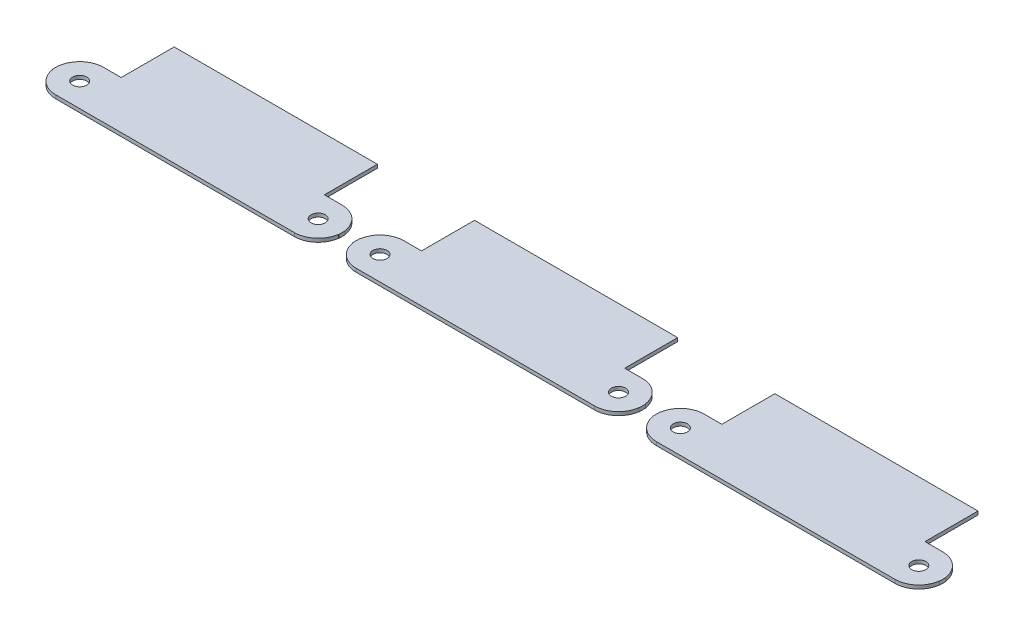
from build123d import *

# Parameters (mm, degrees)
SKETCH1_R           = 2
BOSS_EXTRUDE1_DEPTH = 1
LPATTERN1_COUNT     = 3
LPATTERN1_PITCH     = 85


with BuildPart() as part:
    # Sketch1 → Boss-Extrude1 (new body)
    with BuildSketch(Plane(origin=(0, 0, 0), x_dir=(1, 0, 0), z_dir=(0, 1, 0))):
        with BuildLine():
            Line((5, 6.75), (0, 6.75))
            ThreePointArc((0, 6.75), (-4.405252547, 5.114318136), (-6.675514961, 1))
            Line((-6.675514961, 1), (-6.75, 1))
            Line((-6.75, 1), (-6.75, -1))
            Line((-6.75, -1), (-6.675514961, -1))
            ThreePointArc((-6.675514961, -1), (-4.405252547, -5.114318136), (0, -6.75))
            Line((0, -6.75), (67.5, -6.75))
            ThreePointArc((67.5, -6.75), (71.943393973, -5.081215406), (74.189730936, -0.9))
            Line((74.189730936, -0.9), (74.25, -0.9))
            Line((74.25, -0.9), (74.25, 0.9))
            Line((74.25, 0.9), (74.189730936, 0.9))
            ThreePointArc((74.189730936, 0.9), (71.943393973, 5.081215406), (67.5, 6.75))
            Line((67.5, 6.75), (62.5, 6.75))
            Line((62.5, 6.75), (62.5, 21.75))
            Line((62.5, 21.75), (5, 21.75))
            Line((5, 21.75), (5, 6.75))
        make_face()
        Circle(SKETCH1_R, mode=Mode.SUBTRACT)
        with Locations((67.5, 0)):
            Circle(SKETCH1_R, mode=Mode.SUBTRACT)
    extrude(amount=BOSS_EXTRUDE1_DEPTH)


with BuildPart() as lpattern1_1:
    # LPattern1: pattern copy
    add(part.part.moved(Location(Vector(1, 0, 0) * (1 * LPATTERN1_PITCH))))


with BuildPart() as lpattern1_2:
    # LPattern1: pattern copy
    add(part.part.moved(Location(Vector(1, 0, 0) * (2 * LPATTERN1_PITCH))))


solid = Compound([part.part, lpattern1_1.part, lpattern1_2.part])
